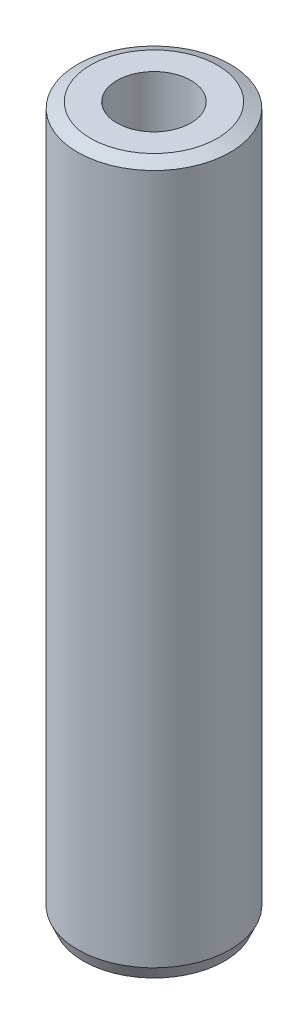
from build123d import *
from OCP.BRepFilletAPI import BRepFilletAPI_MakeChamfer

# Parameters (mm, degrees)
SKETCH1_R           = 7.5
BOSS_EXTRUDE1_DEPTH = 69.710375389
SKETCH2_R           = 3.634915631
CUT_EXTRUDE1_DEPTH  = 71.512668627
CHAMFER1_SIZE       = 0.55843396
CHAMFER1_SIZE2      = 1.260989799


with BuildPart() as part:
    # Sketch1 → Boss-Extrude1 (new body)
    with BuildSketch(Plane(origin=(0, 0, 0), x_dir=(1, 0, 0), z_dir=(0, 1, 0))):
        Circle(SKETCH1_R)
    extrude(amount=BOSS_EXTRUDE1_DEPTH)

    # Sketch2 → Cut-Extrude1 (cut, through all)
    with BuildSketch(Plane(origin=(0, 0, 0), x_dir=(1, 0, 0), z_dir=(0, 1, 0))):
        Circle(SKETCH2_R)
    extrude(amount=CUT_EXTRUDE1_DEPTH, mode=Mode.SUBTRACT)

    # Chamfer1: one chamfer whose edges measure the first distance from different faces: ONE call of the kernel's chamfer builder (chamfer() names one face for all edges)
    chamfer1_edges_1 = [part.edges().sort_by_distance(p)[0] for p in [
        (-7.5, 69.710375389, 0),
    ]]
    chamfer1_side_1 = [part.faces().sort_by_distance(p)[0] for p in [
        (-7.5, 34.855187694, 0),
    ]]
    chamfer1_edges_2 = [part.edges().sort_by_distance(p)[0] for p in [
        (-7.5, 0, 0),
    ]]
    chamfer1_side_2 = [part.faces().sort_by_distance(p)[0] for p in [
        (-7.287867966, 0, 0),
    ]]
    chamfer1 = BRepFilletAPI_MakeChamfer(part.part.solid().wrapped)
    for e in chamfer1_edges_1:
        chamfer1.Add(CHAMFER1_SIZE, CHAMFER1_SIZE2, e.wrapped, chamfer1_side_1[0].wrapped)  # the first distance lies on this face
    for e in chamfer1_edges_2:
        chamfer1.Add(CHAMFER1_SIZE, CHAMFER1_SIZE2, e.wrapped, chamfer1_side_2[0].wrapped)  # the first distance lies on this face
    add(Compound.cast(chamfer1.Shape()), mode=Mode.REPLACE)


solid = part.part
